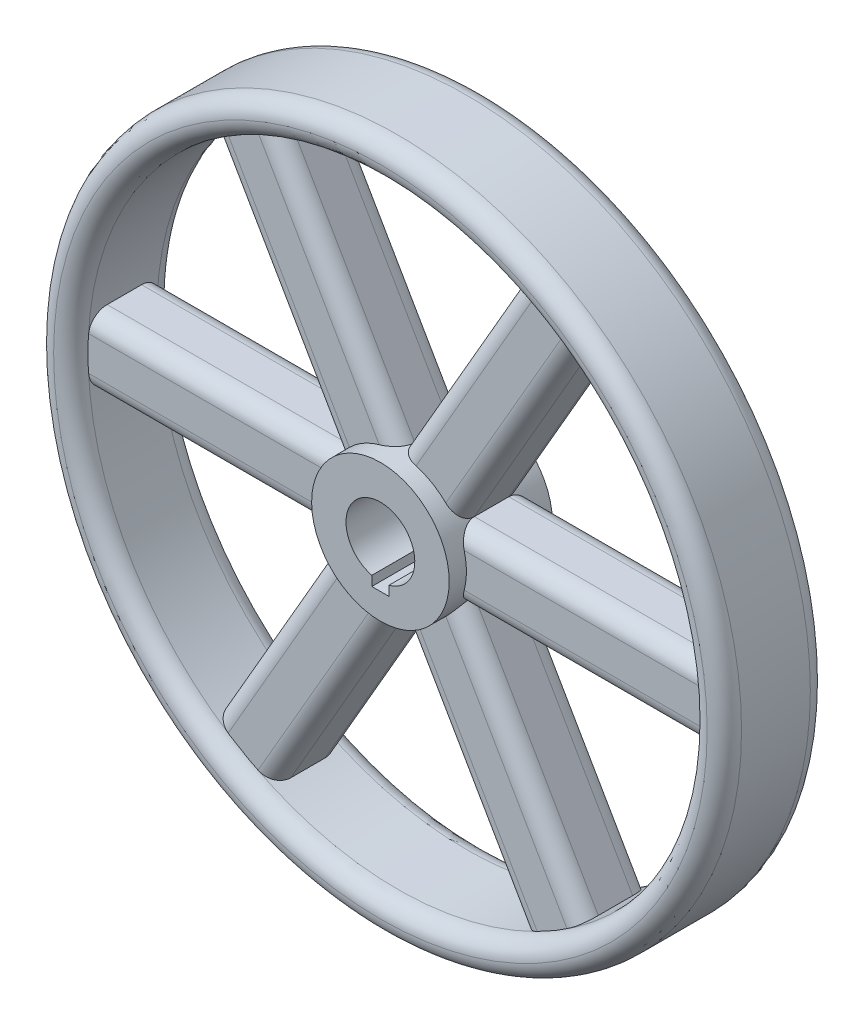
from build123d import *

# Parameters (mm, degrees)
SKETCH1_R           = 100
SKETCH1_R_2         = 90
BOSS_EXTRUDE1_DEPTH = 30
FILLET2_R           = 5
SKETCH2_R           = 20
SKETCH2_R_2         = 10
BOSS_EXTRUDE2_DEPTH = 30
SKETCH5_W           = 5
SKETCH5_H           = 5
CUT_EXTRUDE1_DEPTH  = 185
BOSS_EXTRUDE4_START = -5
SKETCH4_W           = 20
SKETCH4_H           = 20
BOSS_EXTRUDE4_DEPTH = 80
CIRPATTERN3_COUNT   = 6
FILLET7_R           = 5
FILLET8_R           = 5
FILLET9_R           = 5
FILLET10_R          = 5
FILLET11_R          = 5
FILLET12_R          = 5


# Some blends are built 0.0001 mm under size
with BuildPart() as part:
    # Sketch1 → Boss-Extrude1 (new body)
    with BuildSketch(Plane.XY):
        Circle(SKETCH1_R)
        Circle(SKETCH1_R_2, mode=Mode.SUBTRACT)
    extrude(amount=BOSS_EXTRUDE1_DEPTH)

    # Fillet2
    fillet2_edges = [part.edges().sort_by_distance(p)[0] for p in [
        (-100, 0, 30),
        (-100, 0, 0),
        (-90, 0, 0),
        (-90, 0, 30),
    ]]
    fillet(fillet2_edges, radius=FILLET2_R - 0.0001)  # a hair under: the kernel refuses the full size


with BuildPart() as body_2:
    # Sketch2 → Boss-Extrude2 (new body)
    with BuildSketch(Plane.XY):
        Circle(SKETCH2_R)
        Circle(SKETCH2_R_2, mode=Mode.SUBTRACT)
    extrude(amount=BOSS_EXTRUDE2_DEPTH)

    # Sketch5 → Cut-Extrude1 (cut)
    with BuildSketch(Plane.XY.offset(30)):
        with Locations((0, -10)):
            Rectangle(SKETCH5_W, SKETCH5_H)
    extrude(amount=-CUT_EXTRUDE1_DEPTH, mode=Mode.SUBTRACT)

    # Sketch4 → Boss-Extrude4 (add)
    with BuildSketch(Plane(origin=(20, 0, 0), x_dir=(0, 0, -1), z_dir=(1, 0, 0)).offset(BOSS_EXTRUDE4_START)):
        with Locations((-15, 0)):
            Rectangle(SKETCH4_W, SKETCH4_H)
    boss_extrude4 = extrude(amount=BOSS_EXTRUDE4_DEPTH)

    # CirPattern3: Boss-Extrude4 ×6 about axis
    cirpattern3_axis = Axis((0, 0, 0), (0, 0, 1))
    for i in range(1, CIRPATTERN3_COUNT):
        add(boss_extrude4.rotate(cirpattern3_axis, i * 360 / CIRPATTERN3_COUNT))

    # Fillet7
    # the kernel refuses this fillet: 5 mm, written as the material it takes off along each edge
    with BuildSketch(Plane(origin=(-6.25, -9.174682453, 25), x_dir=(0, 0, -1), z_dir=(0.5000000000000001, -0.8660254037844386, 0))) as fillet7_piece_1_section:
        with BuildLine():
            CenterArc((FILLET7_R, FILLET7_R), FILLET7_R, 180, 90)
            Line((0, FILLET7_R), (0, 0))
            Line((0, 0), (FILLET7_R, 0))
        make_face()
    fillet7_piece_1 = extrude(amount=102.679491924, mode=Mode.PRIVATE)
    fillet7_piece_1 = split(fillet7_piece_1, bisect_by=Plane(origin=(-10.855890061, -38.802953147, 23.864462394), z_dir=(0.8660254037844384, -0.5000000000000004, 0)), keep=Keep.TOP, mode=Mode.PRIVATE)
    fillet7_piece_1 = fillet7_piece_1 - Plane(origin=(0, 0, 23.864462394), x_dir=(1, 0, 0), z_dir=(0, 0, -1)) * Cylinder(20, 226, mode=Mode.PRIVATE)
    add(fillet7_piece_1, mode=Mode.SUBTRACT)
    with BuildSketch(Plane(origin=(11.070508076, 0.825317547, 5), x_dir=(-0.8660254037844386, -0.5000000000000002, 0), z_dir=(0.5000000000000001, -0.8660254037844386, 0))) as fillet7_piece_2_section:
        with BuildLine():
            CenterArc((FILLET7_R, -FILLET7_R), FILLET7_R, 90, 90)
            Line((0, -FILLET7_R), (0, 0))
            Line((0, 0), (FILLET7_R, 0))
        make_face()
    fillet7_piece_2 = extrude(amount=102.679491924, mode=Mode.PRIVATE)
    fillet7_piece_2 = fillet7_piece_2 - Plane(origin=(0, 0, 6.13554856), x_dir=(1, 0, 0), z_dir=(0, 0, -1)) * Cylinder(20, 226, mode=Mode.PRIVATE)
    fillet7_piece_2 = split(fillet7_piece_2, bisect_by=Plane(origin=(39.03200339, -10, 6.13554856), z_dir=(0, -1, 0)), keep=Keep.TOP, mode=Mode.PRIVATE)
    add(fillet7_piece_2, mode=Mode.SUBTRACT)
    with BuildSketch(Plane(origin=(-6.25, -9.174682453, 5), x_dir=(0.8660254037844386, 0.5000000000000001, 0), z_dir=(0.5000000000000001, -0.8660254037844386, 0))) as fillet7_piece_3_section:
        with BuildLine():
            CenterArc((FILLET7_R, FILLET7_R), FILLET7_R, 180, 90)
            Line((0, FILLET7_R), (0, 0))
            Line((0, 0), (FILLET7_R, 0))
        make_face()
    fillet7_piece_3 = extrude(amount=102.679491924, mode=Mode.PRIVATE)
    fillet7_piece_3 = fillet7_piece_3 - Plane(origin=(0, 0, 6.135534245), x_dir=(1, 0, 0), z_dir=(0, 0, -1)) * Cylinder(20, 226, mode=Mode.PRIVATE)
    fillet7_piece_3 = split(fillet7_piece_3, bisect_by=Plane(origin=(-10.855937604, -38.803035493, 6.135534245), z_dir=(0.8660254037844384, -0.5000000000000004, 0)), keep=Keep.TOP, mode=Mode.PRIVATE)
    add(fillet7_piece_3, mode=Mode.SUBTRACT)
    with BuildSketch(Plane(origin=(11.070508076, 0.825317547, 25), x_dir=(0, 0, -1), z_dir=(0.5000000000000001, -0.8660254037844386, 0))) as fillet7_piece_4_section:
        with BuildLine():
            CenterArc((FILLET7_R, -FILLET7_R), FILLET7_R, 90, 90)
            Line((0, -FILLET7_R), (0, 0))
            Line((0, 0), (FILLET7_R, 0))
        make_face()
    fillet7_piece_4 = extrude(amount=102.679491924, mode=Mode.PRIVATE)
    fillet7_piece_4 = split(fillet7_piece_4, bisect_by=Plane(origin=(39.032358286, -10, 23.864464664), z_dir=(0, -1, 0)), keep=Keep.TOP, mode=Mode.PRIVATE)
    fillet7_piece_4 = fillet7_piece_4 - Plane(origin=(0, 0, 23.864464664), x_dir=(1, 0, 0), z_dir=(0, 0, -1)) * Cylinder(20, 226, mode=Mode.PRIVATE)
    add(fillet7_piece_4, mode=Mode.SUBTRACT)

    # Fillet8
    # the kernel refuses this fillet: 5 mm, written as the material it takes off along each edge
    with BuildSketch(Plane(origin=(4.820508076, -10, 25), x_dir=(0, 0, -1), z_dir=(1, 0, 0))) as fillet8_piece_1_section:
        with BuildLine():
            CenterArc((FILLET8_R, FILLET8_R), FILLET8_R, 180, 90)
            Line((0, FILLET8_R), (0, 0))
            Line((0, 0), (FILLET8_R, 0))
        make_face()
    fillet8_piece_1 = extrude(amount=102.679491924, mode=Mode.PRIVATE)
    fillet8_piece_1 = fillet8_piece_1 - Plane(origin=(0, 0, 23.864462392), x_dir=(1, 0, 0), z_dir=(0, 0, -1)) * Cylinder(20, 226, mode=Mode.PRIVATE)
    add(fillet8_piece_1, mode=Mode.SUBTRACT)
    with BuildSketch(Plane(origin=(4.820508076, 10, 25), x_dir=(0, 0, -1), z_dir=(1, 0, 0))) as fillet8_piece_2_section:
        with BuildLine():
            CenterArc((FILLET8_R, -FILLET8_R), FILLET8_R, 90, 90)
            Line((0, -FILLET8_R), (0, 0))
            Line((0, 0), (FILLET8_R, 0))
        make_face()
    fillet8_piece_2 = extrude(amount=102.679491924, mode=Mode.PRIVATE)
    fillet8_piece_2 = split(fillet8_piece_2, bisect_by=Plane(origin=(28.176433181, 28.803013845, 23.864464664), z_dir=(0.8660254037844386, -0.5000000000000001, 0)), keep=Keep.TOP, mode=Mode.PRIVATE)
    fillet8_piece_2 = fillet8_piece_2 - Plane(origin=(0, 0, 23.864464664), x_dir=(1, 0, 0), z_dir=(0, 0, -1)) * Cylinder(20, 226, mode=Mode.PRIVATE)
    add(fillet8_piece_2, mode=Mode.SUBTRACT)
    with BuildSketch(Plane(origin=(4.820508076, 10, 5), x_dir=(0, -1, 0), z_dir=(1, 0, 0))) as fillet8_piece_3_section:
        with BuildLine():
            CenterArc((FILLET8_R, -FILLET8_R), FILLET8_R, 90, 90)
            Line((0, -FILLET8_R), (0, 0))
            Line((0, 0), (FILLET8_R, 0))
        make_face()
    fillet8_piece_3 = extrude(amount=102.679491924, mode=Mode.PRIVATE)
    fillet8_piece_3 = fillet8_piece_3 - Plane(origin=(0, 0, 6.13554856), x_dir=(1, 0, 0), z_dir=(0, 0, -1)) * Cylinder(20, 226, mode=Mode.PRIVATE)
    fillet8_piece_3 = split(fillet8_piece_3, bisect_by=Plane(origin=(28.176255733, 28.802706496, 6.13554856), z_dir=(0.8660254037844386, -0.5000000000000001, 0)), keep=Keep.TOP, mode=Mode.PRIVATE)
    add(fillet8_piece_3, mode=Mode.SUBTRACT)
    with BuildSketch(Plane(origin=(4.820508076, -10, 5), x_dir=(0, 1, 0), z_dir=(1, 0, 0))) as fillet8_piece_4_section:
        with BuildLine():
            CenterArc((FILLET8_R, FILLET8_R), FILLET8_R, 180, 90)
            Line((0, FILLET8_R), (0, 0))
            Line((0, 0), (FILLET8_R, 0))
        make_face()
    fillet8_piece_4 = extrude(amount=102.679491924, mode=Mode.PRIVATE)
    fillet8_piece_4 = fillet8_piece_4 - Plane(origin=(0, 0, 7.45), x_dir=(1, 0, 0), z_dir=(0, 0, -1)) * Cylinder(20, 226, mode=Mode.PRIVATE)
    add(fillet8_piece_4, mode=Mode.SUBTRACT)

    # Fillet9
    # the kernel refuses this fillet: 5 mm, written as the material it takes off along each edge
    with BuildSketch(Plane(origin=(11.070508076, -0.825317547, 5), x_dir=(-0.8660254037844386, 0.5000000000000001, 0), z_dir=(0.5000000000000001, 0.8660254037844386, 0))) as fillet9_piece_1_section:
        with BuildLine():
            CenterArc((FILLET9_R, FILLET9_R), FILLET9_R, 180, 90)
            Line((0, FILLET9_R), (0, 0))
            Line((0, 0), (FILLET9_R, 0))
        make_face()
    fillet9_piece_1 = extrude(amount=102.679491924, mode=Mode.PRIVATE)
    fillet9_piece_1 = fillet9_piece_1 - Plane(origin=(0, 0, 7.45), x_dir=(1, 0, 0), z_dir=(0, 0, -1)) * Cylinder(20, 226, mode=Mode.PRIVATE)
    with BuildSketch(Plane(origin=(11.070508076, -0.825317547, 25), x_dir=(0, 0, -1), z_dir=(0.5000000000000001, 0.8660254037844386, 0))) as fillet9_piece_2_section:
        with BuildLine():
            CenterArc((FILLET9_R, FILLET9_R), FILLET9_R, 180, 90)
            Line((0, FILLET9_R), (0, 0))
            Line((0, 0), (FILLET9_R, 0))
        make_face()
    fillet9_piece_2 = extrude(amount=102.679491924, mode=Mode.PRIVATE)
    fillet9_piece_2 = fillet9_piece_2 - Plane(origin=(0, 0, 23.864461778), x_dir=(1, 0, 0), z_dir=(0, 0, -1)) * Cylinder(20, 226, mode=Mode.PRIVATE)
    with BuildSketch(Plane(origin=(-6.25, 9.174682453, 5), x_dir=(0.8660254037844385, -0.5000000000000001, 0), z_dir=(0.5000000000000001, 0.8660254037844386, 0))) as fillet9_piece_3_section:
        with BuildLine():
            CenterArc((FILLET9_R, -FILLET9_R), FILLET9_R, 90, 90)
            Line((0, -FILLET9_R), (0, 0))
            Line((0, 0), (FILLET9_R, 0))
        make_face()
    fillet9_piece_3 = extrude(amount=102.679491924, mode=Mode.PRIVATE)
    fillet9_piece_3 = fillet9_piece_3 - Plane(origin=(0, 0, 6.13554856), x_dir=(1, 0, 0), z_dir=(0, 0, -1)) * Cylinder(20, 226, mode=Mode.PRIVATE)
    fillet9_piece_3 = split(fillet9_piece_3, bisect_by=Plane(origin=(-10.855747657, 38.802706496, 6.13554856), z_dir=(0.8660254037844388, 0.49999999999999983, 0)), keep=Keep.TOP, mode=Mode.PRIVATE)
    with BuildSketch(Plane(origin=(-6.25, 9.174682453, 25), x_dir=(0, 0, -1), z_dir=(0.5000000000000001, 0.8660254037844386, 0))) as fillet9_piece_4_section:
        with BuildLine():
            CenterArc((FILLET9_R, -FILLET9_R), FILLET9_R, 90, 90)
            Line((0, -FILLET9_R), (0, 0))
            Line((0, 0), (FILLET9_R, 0))
        make_face()
    fillet9_piece_4 = extrude(amount=102.679491924, mode=Mode.PRIVATE)
    fillet9_piece_4 = fillet9_piece_4 - Plane(origin=(0, 0, 23.864463015), x_dir=(1, 0, 0), z_dir=(0, 0, -1)) * Cylinder(20, 226, mode=Mode.PRIVATE)
    fillet9_piece_4 = split(fillet9_piece_4, bisect_by=Plane(origin=(-10.855904933, 38.802978906, 23.864463015), z_dir=(0.8660254037844388, 0.49999999999999983, 0)), keep=Keep.TOP, mode=Mode.PRIVATE)
    add([fillet9_piece_1, fillet9_piece_2, fillet9_piece_3, fillet9_piece_4], mode=Mode.SUBTRACT)

    # Fillet10
    # the kernel refuses this fillet: 5 mm, written as the material it takes off along each edge
    with BuildSketch(Plane(origin=(6.25, 9.174682453, 5), x_dir=(-0.8660254037844387, -0.49999999999999983, 0), z_dir=(-0.49999999999999983, 0.8660254037844388, 0))) as fillet10_piece_1_section:
        with BuildLine():
            CenterArc((FILLET10_R, FILLET10_R), FILLET10_R, 180, 90)
            Line((0, FILLET10_R), (0, 0))
            Line((0, 0), (FILLET10_R, 0))
        make_face()
    fillet10_piece_1 = extrude(amount=102.679491924, mode=Mode.PRIVATE)
    fillet10_piece_1 = fillet10_piece_1 - Plane(origin=(0, 0, 7.45), x_dir=(1, 0, 0), z_dir=(0, 0, -1)) * Cylinder(20, 226, mode=Mode.PRIVATE)
    add(fillet10_piece_1, mode=Mode.SUBTRACT)
    with BuildSketch(Plane(origin=(6.25, 9.174682453, 25), x_dir=(0, 0, -1), z_dir=(-0.49999999999999983, 0.8660254037844388, 0))) as fillet10_piece_2_section:
        with BuildLine():
            CenterArc((FILLET10_R, FILLET10_R), FILLET10_R, 180, 90)
            Line((0, FILLET10_R), (0, 0))
            Line((0, 0), (FILLET10_R, 0))
        make_face()
    fillet10_piece_2 = extrude(amount=102.679491924, mode=Mode.PRIVATE)
    fillet10_piece_2 = fillet10_piece_2 - Plane(origin=(0, 0, 23.864461778), x_dir=(1, 0, 0), z_dir=(0, 0, -1)) * Cylinder(20, 226, mode=Mode.PRIVATE)
    add(fillet10_piece_2, mode=Mode.SUBTRACT)
    with BuildSketch(Plane(origin=(-11.070508076, -0.825317547, 5), x_dir=(0.8660254037844387, 0.4999999999999997, 0), z_dir=(-0.49999999999999983, 0.8660254037844388, 0))) as fillet10_piece_3_section:
        with BuildLine():
            CenterArc((FILLET10_R, -FILLET10_R), FILLET10_R, 90, 90)
            Line((0, -FILLET10_R), (0, 0))
            Line((0, 0), (FILLET10_R, 0))
        make_face()
    fillet10_piece_3 = extrude(amount=102.679491924, mode=Mode.PRIVATE)
    fillet10_piece_3 = fillet10_piece_3 - Plane(origin=(0, 0, 6.13554856), x_dir=(1, 0, 0), z_dir=(0, 0, -1)) * Cylinder(20, 226, mode=Mode.PRIVATE)
    fillet10_piece_3 = split(fillet10_piece_3, bisect_by=Plane(origin=(-39.03200339, 10, 6.13554856), z_dir=(0, 1, 0)), keep=Keep.TOP, mode=Mode.PRIVATE)
    add(fillet10_piece_3, mode=Mode.SUBTRACT)
    with BuildSketch(Plane(origin=(-11.070508076, -0.825317547, 25), x_dir=(0, 0, -1), z_dir=(-0.49999999999999983, 0.8660254037844388, 0))) as fillet10_piece_4_section:
        with BuildLine():
            CenterArc((FILLET10_R, -FILLET10_R), FILLET10_R, 90, 90)
            Line((0, -FILLET10_R), (0, 0))
            Line((0, 0), (FILLET10_R, 0))
        make_face()
    fillet10_piece_4 = extrude(amount=102.679491924, mode=Mode.PRIVATE)
    fillet10_piece_4 = fillet10_piece_4 - Plane(origin=(0, 0, 23.864461743), x_dir=(1, 0, 0), z_dir=(0, 0, -1)) * Cylinder(20, 226, mode=Mode.PRIVATE)
    fillet10_piece_4 = split(fillet10_piece_4, bisect_by=Plane(origin=(-39.032329043, 10, 23.864461743), z_dir=(0, 1, 0)), keep=Keep.TOP, mode=Mode.PRIVATE)
    add(fillet10_piece_4, mode=Mode.SUBTRACT)

    # Fillet11
    # the kernel refuses this fillet: 5 mm, written as the material it takes off along each edge
    with BuildSketch(Plane(origin=(-4.820508076, 10, 25), x_dir=(0, 0, -1), z_dir=(-1, 0, 0))) as fillet11_piece_1_section:
        with BuildLine():
            CenterArc((FILLET11_R, FILLET11_R), FILLET11_R, 180, 90)
            Line((0, FILLET11_R), (0, 0))
            Line((0, 0), (FILLET11_R, 0))
        make_face()
    fillet11_piece_1 = extrude(amount=102.679491924, mode=Mode.PRIVATE)
    fillet11_piece_1 = fillet11_piece_1 - Plane(origin=(0, 0, 23.864464664), x_dir=(1, 0, 0), z_dir=(0, 0, -1)) * Cylinder(20, 226, mode=Mode.PRIVATE)
    add(fillet11_piece_1, mode=Mode.SUBTRACT)
    with BuildSketch(Plane(origin=(-4.820508076, -10, 5), x_dir=(0, 1, 0), z_dir=(-1, 0, 0))) as fillet11_piece_2_section:
        with BuildLine():
            CenterArc((FILLET11_R, -FILLET11_R), FILLET11_R, 90, 90)
            Line((0, -FILLET11_R), (0, 0))
            Line((0, 0), (FILLET11_R, 0))
        make_face()
    fillet11_piece_2 = extrude(amount=102.679491924, mode=Mode.PRIVATE)
    fillet11_piece_2 = fillet11_piece_2 - Plane(origin=(0, 0, 6.13554856), x_dir=(1, 0, 0), z_dir=(0, 0, -1)) * Cylinder(20, 226, mode=Mode.PRIVATE)
    fillet11_piece_2 = split(fillet11_piece_2, bisect_by=Plane(origin=(-28.176255733, -28.802706496, 6.13554856), z_dir=(-0.8660254037844384, 0.5000000000000004, 0)), keep=Keep.TOP, mode=Mode.PRIVATE)
    add(fillet11_piece_2, mode=Mode.SUBTRACT)
    with BuildSketch(Plane(origin=(-4.820508076, 10, 5), x_dir=(0, 0, 1), z_dir=(-1, 0, 0))) as fillet11_piece_3_section:
        with BuildLine():
            CenterArc((FILLET11_R, -FILLET11_R), FILLET11_R, 90, 90)
            Line((0, -FILLET11_R), (0, 0))
            Line((0, 0), (FILLET11_R, 0))
        make_face()
    fillet11_piece_3 = extrude(amount=102.679491924, mode=Mode.PRIVATE)
    fillet11_piece_3 = fillet11_piece_3 - Plane(origin=(0, 0, 6.135538222), x_dir=(1, 0, 0), z_dir=(0, 0, -1)) * Cylinder(20, 226, mode=Mode.PRIVATE)
    add(fillet11_piece_3, mode=Mode.SUBTRACT)
    with BuildSketch(Plane(origin=(-4.820508076, -10, 25), x_dir=(0, 1, 0), z_dir=(-1, 0, 0))) as fillet11_piece_4_section:
        with BuildLine():
            CenterArc((FILLET11_R, FILLET11_R), FILLET11_R, 180, 90)
            Line((0, FILLET11_R), (0, 0))
            Line((0, 0), (FILLET11_R, 0))
        make_face()
    fillet11_piece_4 = extrude(amount=102.679491924, mode=Mode.PRIVATE)
    fillet11_piece_4 = fillet11_piece_4 - Plane(origin=(0, 0, 23.86445144), x_dir=(1, 0, 0), z_dir=(0, 0, -1)) * Cylinder(20, 226, mode=Mode.PRIVATE)
    fillet11_piece_4 = split(fillet11_piece_4, bisect_by=Plane(origin=(-28.176255733, -28.802706496, 23.86445144), z_dir=(-0.8660254037844384, 0.5000000000000004, 0)), keep=Keep.TOP, mode=Mode.PRIVATE)
    add(fillet11_piece_4, mode=Mode.SUBTRACT)

    # Fillet12
    fillet12_edges = [body_2.edges().sort_by_distance(p)[0] for p in [
        (-36.740381057, -43.63620668, 25),
        (-19.419872981, -53.63620668, 5),
        (-36.740381057, -43.63620668, 5),
        (-19.419872981, -53.63620668, 25),
    ]]
    fillet(fillet12_edges, radius=FILLET12_R)


solid = Compound([part.part, body_2.part])
